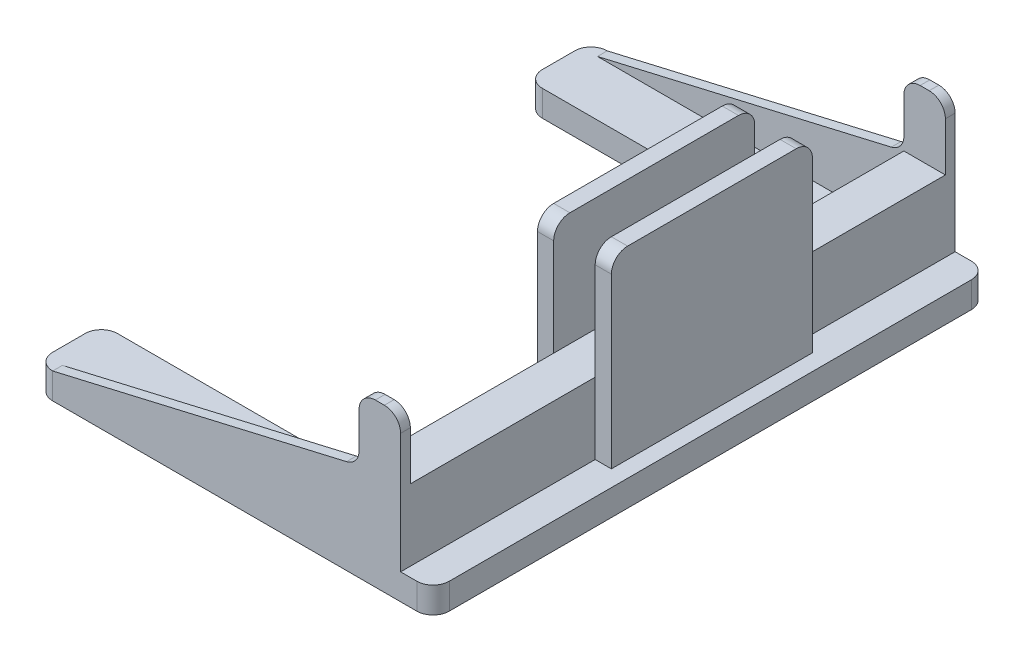
from build123d import *

# Parameters (mm, degrees)
P_IDAT_VYSUNUT_M1_DEPTH  = 85.5
SKICA2_W                 = 49
SKICA2_H                 = 35
SKICA2_W_2               = 60
ODEBRAT_VYSUNUT_M1_DEPTH = 144.057680675
SKICA3_W                 = 5
SKICA3_H                 = 49
SKICA3_H_2               = 60
ODEBRAT_VYSUNUT_M2_DEPTH = 22
SKICA4_W                 = 94.5
SKICA4_H                 = 131
ODEBRAT_VYSUNUT_M3_DEPTH = 160.73897458
ZAOBLIT1_R               = 5
ZAOBLIT2_R               = 20
ZAOBLIT3_R               = 5
P_IDAT_VYSUNUT_M2_DEPTH  = 3
SKICA6_W                 = 12.8
SKICA6_H                 = 3
P_IDAT_VYSUNUT_M3_DEPTH  = 20
ZAOBLIT4_R               = 5


with BuildPart() as part:
    # Skica1 → Přidat vysunutím1 (new, symmetric)
    with BuildSketch(Plane.XY):
        Polygon((-27.8, 65), (-27.8, 8), (-122.3, 8), (-122.3, 0), (0, 0), (0, 8), (-5, 8), (-5, 65), (-10, 65), (-10, 30), (-22.8, 30), (-22.8, 65), align=None)
    extrude(amount=P_IDAT_VYSUNUT_M1_DEPTH, both=True)

    # Skica2 → Odebrat vysunutím1 (cut, through all)
    with BuildSketch(Plane.ZY.offset(27.8)):
        with Locations((-61, 47.5)):
            Rectangle(SKICA2_W, SKICA2_H)
        with Locations((55.5, 47.5)):
            Rectangle(SKICA2_W_2, SKICA2_H)
    extrude(amount=-ODEBRAT_VYSUNUT_M1_DEPTH, mode=Mode.SUBTRACT)

    # Skica3 → Odebrat vysunutím2 (cut)
    with BuildSketch(Plane(origin=(0, 30, 0), x_dir=(1, 0, 0), z_dir=(0, 1, 0))):
        with Locations((-25.3, 61)):
            Rectangle(SKICA3_W, SKICA3_H)
        with Locations((-7.5, 61)):
            Rectangle(SKICA3_W, SKICA3_H)
        with Locations((-25.3, -55.5)):
            Rectangle(SKICA3_W, SKICA3_H_2)
        with Locations((-7.5, -55.5)):
            Rectangle(SKICA3_W, SKICA3_H_2)
    extrude(amount=-ODEBRAT_VYSUNUT_M2_DEPTH, mode=Mode.SUBTRACT)

    # Skica4 → Odebrat vysunutím3 (cut, through all)
    with BuildSketch(Plane(origin=(0, 8, 0), x_dir=(1, 0, 0), z_dir=(0, 1, 0))):
        with Locations((-75.05, 0)):
            Rectangle(SKICA4_W, SKICA4_H)
    extrude(amount=-ODEBRAT_VYSUNUT_M3_DEPTH, mode=Mode.SUBTRACT)

    # Zaoblit1
    zaoblit1_edges = [part.edges().sort_by_distance(p)[0] for p in [
        (0, 4, -85.5),
        (-122.3, 4, 65.5),
        (-122.3, 4, -65.5),
        (-122.3, 4, -85.5),
        (-122.3, 4, 85.5),
        (0, 4, 85.5),
    ]]
    fillet(zaoblit1_edges, radius=ZAOBLIT1_R)

    # Zaoblit2
    zaoblit2_edges = [part.edges().sort_by_distance(p)[0] for p in [
        (-27.8, 4, -65.5),
        (-27.8, 4, 65.5),
    ]]
    fillet(zaoblit2_edges, radius=ZAOBLIT2_R)

    # Zaoblit3
    zaoblit3_edges = [part.edges().sort_by_distance(p)[0] for p in [
        (-7.5, 65, -36.5),
        (-25.3, 65, -36.5),
        (-25.3, 65, 25.5),
        (-7.5, 65, 25.5),
    ]]
    fillet(zaoblit3_edges, radius=ZAOBLIT3_R)

    # Skica5 → Přidat vysunutím2 (add)
    with BuildSketch(Plane(origin=(0, 0, -85.5), x_dir=(-1, 0, 0), z_dir=(0, 0, -1))):
        Polygon((22.8, 30), (22.8, 8), (117.3, 8), align=None)
    p_idat_vysunut_m2 = extrude(amount=-P_IDAT_VYSUNUT_M2_DEPTH)

    # Zrcadlit1: Přidat vysunutím2 across plane
    add(p_idat_vysunut_m2.mirror(Plane.XY))

    # Skica6 → Přidat vysunutím3 (add)
    with BuildSketch(Plane(origin=(0, 30, 0), x_dir=(1, 0, 0), z_dir=(0, 1, 0))):
        with Locations((-16.4, 84)):
            Rectangle(SKICA6_W, SKICA6_H)
        with Locations((-16.4, -84)):
            Rectangle(SKICA6_W, SKICA6_H)
    extrude(amount=P_IDAT_VYSUNUT_M3_DEPTH)

    # Zaoblit4
    # the kernel refuses this fillet: 5 mm, written as the material it adds along each edge
    with BuildSketch(Plane(origin=(-22.8, 30, 85.5), x_dir=(0, 1, 0), z_dir=(0, 0, -1)), Plane(origin=(-22.8, 30, -85.5), x_dir=(-0.9739551200282253, -0.22674087450392655, 0), z_dir=(0, 0, 1))) as zaoblit4_piece_1:
        with BuildLine():
            CenterArc((ZAOBLIT4_R * 0.793937122558, -ZAOBLIT4_R), ZAOBLIT4_R, 90, 76.89473101)
            Line((-ZAOBLIT4_R * 0.18001799747, -ZAOBLIT4_R * 0.773259125496), (0, 0))
            Line((0, 0), (ZAOBLIT4_R * 0.793937122558, 0))
        make_face()
    extrude(amount=3)
    # the kernel refuses this fillet: 5 mm, written as the material it takes off along each edge
    with BuildSketch(Plane(origin=(-22.8, 50, -98), x_dir=(1, 0, 0), z_dir=(0, 0, 1)), Plane(origin=(-10, 50, 70), x_dir=(0, -1, 0), z_dir=(0, 0, 1))) as zaoblit4_2_piece_1:
        with BuildLine():
            CenterArc((ZAOBLIT4_R, -ZAOBLIT4_R), ZAOBLIT4_R, 90, 90)
            Line((0, -ZAOBLIT4_R), (0, 0))
            Line((0, 0), (ZAOBLIT4_R, 0))
        make_face()
    extrude(amount=28, mode=Mode.SUBTRACT)
    with BuildSketch(Plane(origin=(-10, 50, -70), x_dir=(0, -1, 0), z_dir=(0, 0, -1)), Plane(origin=(-22.8, 50, 98), x_dir=(1, 0, 0), z_dir=(0, 0, -1))) as zaoblit4_2_piece_2:
        with BuildLine():
            CenterArc((ZAOBLIT4_R, ZAOBLIT4_R), ZAOBLIT4_R, 180, 90)
            Line((0, ZAOBLIT4_R), (0, 0))
            Line((0, 0), (ZAOBLIT4_R, 0))
        make_face()
    extrude(amount=28, mode=Mode.SUBTRACT)


solid = part.part
